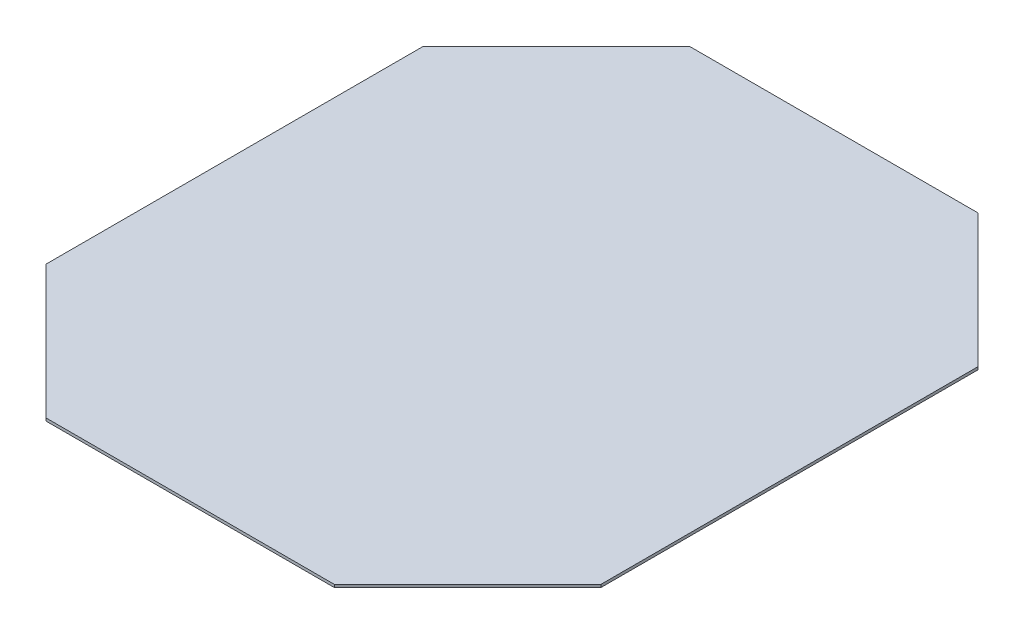
from build123d import *

# Parameters (mm, degrees)
SKETCH1_W           = 635
SKETCH1_H           = 736.6
BASE_DEPTH          = 3.175
MODULE_CUTOUT_DEPTH = 487.272784171


with BuildPart() as part:
    # Sketch1 → Base (new body)
    with BuildSketch(Plane(origin=(0, 0, 0), x_dir=(1, 0, 0), z_dir=(0, 1, 0))):
        Rectangle(SKETCH1_W, SKETCH1_H)
    extrude(amount=BASE_DEPTH)

    # Sketch2 → Module Cutout (cut, through all)
    with BuildSketch(Plane(origin=(0, 0, 0), x_dir=(-1, 0, 0), z_dir=(0, -1, 0))):
        Polygon((-317.5, 215.9), (-165.1, 368.3), (-317.5, 368.3), align=None)
        Polygon((165.1, 368.3), (317.5, 215.9), (317.5, 368.3), align=None)
        Polygon((317.5, -215.9), (165.1, -368.3), (317.5, -368.3), align=None)
        Polygon((-317.5, -215.9), (-165.1, -368.3), (-317.5, -368.3), align=None)
    extrude(amount=-MODULE_CUTOUT_DEPTH, mode=Mode.SUBTRACT)


solid = part.part
